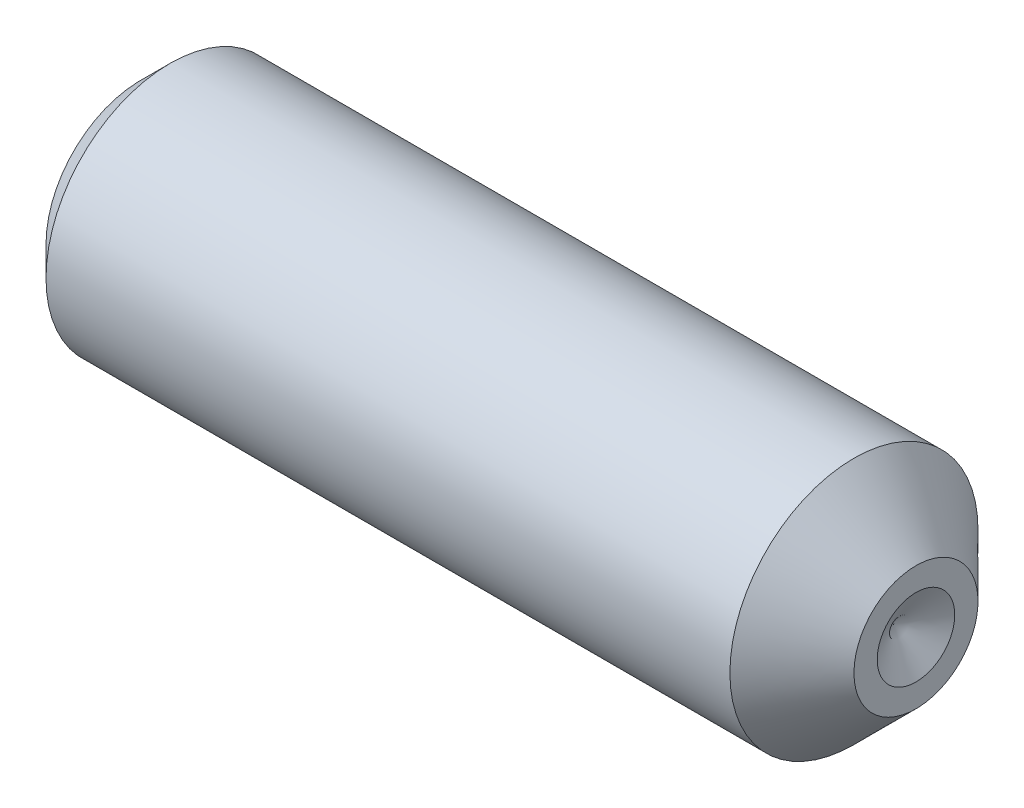
from build123d import *

# Parameters (mm, degrees)
HEXAGONSOCKET_DEPTH = 0.7


with BuildPart() as part:
    # Sketch1 → Base (revolve)
    with BuildSketch(Plane.XY):
        Polygon((0, 0), (5, 0), (5, 0.4), (4.6, 0.8), (0.1895, 0.8), (0, 0.6105), align=None)
    revolve(axis=Axis((-10.745014543, 0, 0), (1, 0, 0)))

    # Sketch2 → HexagonSocket (cut)
    with BuildSketch(Plane(origin=(0, 0.180497073, -0.295782572), x_dir=(0, 0, 1), z_dir=(-1, 0, 0))):
        Polygon((0.69992776, -0.180497073), (0.497855166, 0.169502927), (0.093709977, 0.169502927), (-0.108362617, -0.180497073), (0.093709977, -0.530497073), (0.497855166, -0.530497073), align=None)
    extrude(amount=-HEXAGONSOCKET_DEPTH, mode=Mode.SUBTRACT)

    # Cut-Extrude1 cone 1 section (through the dimple's axis) → Cut-Extrude1 (revolve, cut)
    with BuildSketch(Plane(origin=(5, 0, 0), x_dir=(0, 0, -1), z_dir=(0, 1, 0))):
        Polygon((0, 0), (0.25, 0), (0, 0.144337567), align=None)
    revolve(axis=Axis((5, 0, 0), (-1, 0, 0)), mode=Mode.SUBTRACT)

    # Sketch4 → Cut-Revolve1 (revolve, cut)
    with BuildSketch(Plane.XY):
        Polygon((0.7, 0.35), (0.902072594, 0), (0.7, 0), align=None)
    revolve(axis=Axis((0.237226277, 0, 0), (-1, 0, 0)), mode=Mode.SUBTRACT)


solid = part.part
